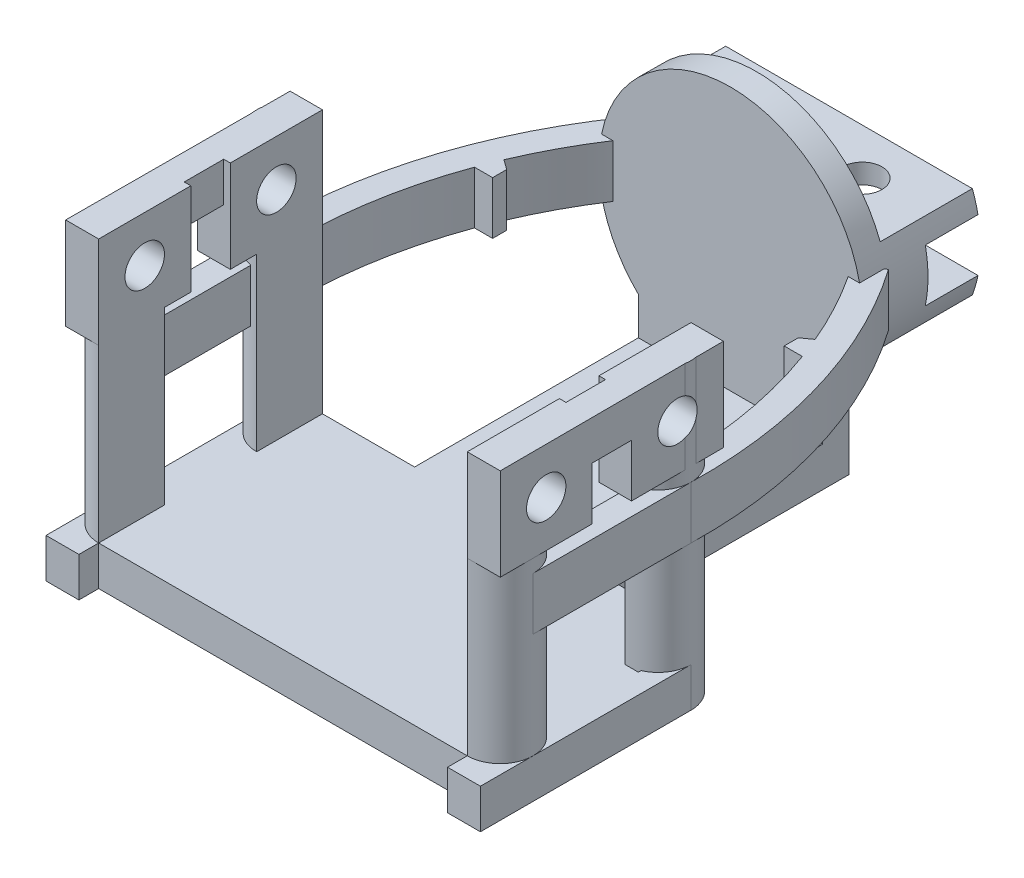
from build123d import *
from build123d.topology import SkipClean

# Parameters (mm, degrees)
BOSS_EXTRUDE1_DEPTH      = 10
BOSS_EXTRUDE2_START      = -1.5
BOSS_EXTRUDE2_DEPTH      = 1.5
SKETCH3_W                = 7
SKETCH3_H                = 1.5
BOSS_EXTRUDE3_DEPTH      = 9.5
SKETCH4_R                = 5
BOSS_EXTRUDE4_DEPTH      = 1
BOSS_EXTRUDE5_DEPTH      = 1
BOSS_EXTRUDE5_DEPTH_BACK = 1
BOSS_EXTRUDE7_START      = -1.5
BOSS_EXTRUDE7_DEPTH      = 1.5
BOSS_EXTRUDE9_DEPTH      = 0.75
BOSS_EXTRUDE9_DEPTH_BACK = 1.5
SKETCH11_W               = 1.25
SKETCH11_H               = 1.5
BOSS_EXTRUDE12_START     = 6.5
BOSS_EXTRUDE12_DEPTH     = 3.5
CUT_EXTRUDE9_DEPTH       = 2
CUT_EXTRUDE9_DEPTH_BACK  = 2
SKETCH16_3_R             = 0.75
BOSS_EXTRUDE13_REACH     = 24.842
SKETCH17_W               = 3.5
SKETCH17_H               = 3.5
SKETCH17_R               = 0.75
CUT_EXTRUDE10_DEPTH      = 2
CUT_EXTRUDE10_DEPTH_BACK = 3
SKETCH17_3_R             = 0.75
BOSS_EXTRUDE14_START     = 3.5
SKETCH18_W               = 4
SKETCH18_H               = 2
BOSS_EXTRUDE14_DEPTH     = 3.5
CUT_EXTRUDE11_DEPTH      = 21.827162
CUT_EXTRUDE11_DEPTH_BACK = 21.827162
SKETCH19_R               = 0.75
SKETCH20_W               = 1.680832
SKETCH20_H               = 2
CUT_EXTRUDE12_DEPTH      = 2
BOSS_EXTRUDE15_START     = -2
BOSS_EXTRUDE15_DEPTH     = 2


# Read off the part's stored shape, not the designer's step: Boss-Extrude12
with BuildPart() as part:
    # Sketch1 → Boss-Extrude1 (new body)
    with BuildSketch(Plane(origin=(0, 0, 0), x_dir=(1, 0, 0), z_dir=(0, 1, 0))):
        with BuildLine():
            ThreePointArc((-7.5, 1.854356), (-7.255387, 1.776367), (-7, 1.75))
            Line((-7, 1.75), (-7, 2.25))
            ThreePointArc((-7, 2.25), (-7.267617, 2.299371), (-7.5, 2.440983))
            Line((-7.5, 2.440983), (-7.5, 1.854356))
        make_face()
        with BuildLine():
            ThreePointArc((-7.5, 3.559017), (-7.267617, 3.700629), (-7, 3.75))
            Line((-7, 3.75), (-7, 4.25))
            ThreePointArc((-7, 4.25), (-7.255387, 4.223633), (-7.5, 4.145644))
            Line((-7.5, 4.145644), (-7.5, 3.559017))
        make_face()
        with BuildLine():
            ThreePointArc((-7.5, 2.440983), (-7.267617, 2.299371), (-7, 2.25))
            Line((-7, 2.25), (-7, 3.75))
            ThreePointArc((-7, 3.75), (-7.267617, 3.700629), (-7.5, 3.559017))
            Line((-7.5, 3.559017), (-7.5, 2.440983))
        make_face()
        with BuildLine():
            ThreePointArc((-8.25, 3), (-8.045825, 2.315347), (-7.5, 1.854356))
            Line((-7.5, 1.854356), (-7.5, 2.440983))
            ThreePointArc((-7.5, 2.440983), (-7.75, 3), (-7.5, 3.559017))
            Line((-7.5, 3.559017), (-7.5, 4.145644))
            ThreePointArc((-7.5, 4.145644), (-8.045825, 3.684653), (-8.25, 3))
        make_face()
        with BuildLine():
            Line((-7.5, -2.440983), (-7.5, -1.854356))
            ThreePointArc((-7.5, -1.854356), (-8.045825, -2.315347), (-8.25, -3))
            ThreePointArc((-8.25, -3), (-8.045825, -3.684653), (-7.5, -4.145644))
            Line((-7.5, -4.145644), (-7.5, -3.559017))
            ThreePointArc((-7.5, -3.559017), (-7.75, -3), (-7.5, -2.440983))
        make_face()
        with BuildLine():
            Line((-7, -2.25), (-7, -1.75))
            ThreePointArc((-7, -1.75), (-7.255387, -1.776367), (-7.5, -1.854356))
            Line((-7.5, -1.854356), (-7.5, -2.440983))
            ThreePointArc((-7.5, -2.440983), (-7.267617, -2.299371), (-7, -2.25))
        make_face()
        with BuildLine():
            Line((-7, -4.25), (-7, -3.75))
            ThreePointArc((-7, -3.75), (-7.267617, -3.700629), (-7.5, -3.559017))
            Line((-7.5, -3.559017), (-7.5, -4.145644))
            ThreePointArc((-7.5, -4.145644), (-7.255387, -4.223633), (-7, -4.25))
        make_face()
        with BuildLine():
            Line((-7, -3.75), (-7, -2.25))
            ThreePointArc((-7, -2.25), (-7.267617, -2.299371), (-7.5, -2.440983))
            Line((-7.5, -2.440983), (-7.5, -3.559017))
            ThreePointArc((-7.5, -3.559017), (-7.267617, -3.700629), (-7, -3.75))
        make_face()
        with BuildLine():
            Line((7, -2.25), (7, -3.75))
            ThreePointArc((7, -3.75), (7.267617, -3.700629), (7.5, -3.559017))
            Line((7.5, -3.559017), (7.5, -2.440983))
            ThreePointArc((7.5, -2.440983), (7.267617, -2.299371), (7, -2.25))
        make_face()
        with BuildLine():
            Line((7, -3.75), (7, -4.25))
            ThreePointArc((7, -4.25), (7.255387, -4.223633), (7.5, -4.145644))
            Line((7.5, -4.145644), (7.5, -3.559017))
            ThreePointArc((7.5, -3.559017), (7.267617, -3.700629), (7, -3.75))
        make_face()
        with BuildLine():
            ThreePointArc((7.5, -1.854356), (7.255387, -1.776367), (7, -1.75))
            Line((7, -1.75), (7, -2.25))
            ThreePointArc((7, -2.25), (7.267617, -2.299371), (7.5, -2.440983))
            Line((7.5, -2.440983), (7.5, -1.854356))
        make_face()
        with BuildLine():
            Line((7.5, -3.559017), (7.5, -4.145644))
            ThreePointArc((7.5, -4.145644), (8.045825, -3.684653), (8.25, -3))
            ThreePointArc((8.25, -3), (8.045825, -2.315347), (7.5, -1.854356))
            Line((7.5, -1.854356), (7.5, -2.440983))
            ThreePointArc((7.5, -2.440983), (7.684653, -2.693814), (7.75, -3))
            ThreePointArc((7.75, -3), (7.684653, -3.306186), (7.5, -3.559017))
        make_face()
        with BuildLine():
            ThreePointArc((7.5, 3.559017), (7.267617, 3.700629), (7, 3.75))
            Line((7, 3.75), (7, 2.25))
            ThreePointArc((7, 2.25), (7.267617, 2.299371), (7.5, 2.440983))
            Line((7.5, 2.440983), (7.5, 3.559017))
        make_face()
        with BuildLine():
            ThreePointArc((7.5, 4.145644), (7.255387, 4.223633), (7, 4.25))
            Line((7, 4.25), (7, 3.75))
            ThreePointArc((7, 3.75), (7.267617, 3.700629), (7.5, 3.559017))
            Line((7.5, 3.559017), (7.5, 4.145644))
        make_face()
        with BuildLine():
            Line((7, 2.25), (7, 1.75))
            ThreePointArc((7, 1.75), (7.255387, 1.776367), (7.5, 1.854356))
            Line((7.5, 1.854356), (7.5, 2.440983))
            ThreePointArc((7.5, 2.440983), (7.267617, 2.299371), (7, 2.25))
        make_face()
        with BuildLine():
            ThreePointArc((8.25, 3), (8.045825, 3.684653), (7.5, 4.145644))
            Line((7.5, 4.145644), (7.5, 3.559017))
            ThreePointArc((7.5, 3.559017), (7.684653, 3.306186), (7.75, 3))
            ThreePointArc((7.75, 3), (7.684653, 2.693814), (7.5, 2.440983))
            Line((7.5, 2.440983), (7.5, 1.854356))
            ThreePointArc((7.5, 1.854356), (8.045825, 2.315347), (8.25, 3))
        make_face()
    extrude(amount=BOSS_EXTRUDE1_DEPTH)

    # Sketch1<5> → Boss-Extrude2 (add)
    with BuildSketch(Plane(origin=(0, 0, 0), x_dir=(1, 0, 0), z_dir=(0, 1, 0)).offset(BOSS_EXTRUDE2_START)):
        with BuildLine():
            Line((-7, -1.75), (-7, 1.75))
            Line((-7, 1.75), (-7.5, 1.75))
            Line((-7.5, 1.75), (-7.5, 1.854356))
            ThreePointArc((-7.5, 1.854356), (-8.045825, 2.315347), (-8.25, 3))
            Line((-8.25, 3), (-8.25, -3))
            ThreePointArc((-8.25, -3), (-8.045825, -2.315347), (-7.5, -1.854356))
            Line((-7.5, -1.854356), (-7.5, -1.75))
            Line((-7.5, -1.75), (-7, -1.75))
        make_face()
        with BuildLine():
            ThreePointArc((-5.75, 3), (-6.116117, 2.116117), (-7, 1.75))
            Line((-7, 1.75), (-7, -1.75))
            ThreePointArc((-7, -1.75), (-6.116117, -2.116117), (-5.75, -3))
            ThreePointArc((-5.75, -3), (-6.116117, -3.883883), (-7, -4.25))
            Line((-7, -4.25), (7, -4.25))
            ThreePointArc((7, -4.25), (5.75, -3), (7, -1.75))
            Line((7, -1.75), (7, 1.75))
            ThreePointArc((7, 1.75), (5.75, 3), (7, 4.25))
            Line((7, 4.25), (-7, 4.25))
            ThreePointArc((-7, 4.25), (-6.116117, 3.883883), (-5.75, 3))
        make_face()
        with BuildLine():
            Line((-7, 2.25), (-7, 1.75))
            ThreePointArc((-7, 1.75), (-6.116117, 2.116117), (-5.75, 3))
            ThreePointArc((-5.75, 3), (-6.116117, 3.883883), (-7, 4.25))
            Line((-7, 4.25), (-7, 3.75))
            ThreePointArc((-7, 3.75), (-6.46967, 3.53033), (-6.25, 3))
            ThreePointArc((-6.25, 3), (-6.46967, 2.46967), (-7, 2.25))
        make_face()
        with BuildLine():
            ThreePointArc((-8.25, 3), (-8.045825, 2.315347), (-7.5, 1.854356))
            Line((-7.5, 1.854356), (-7.5, 2.440983))
            ThreePointArc((-7.5, 2.440983), (-7.75, 3), (-7.5, 3.559017))
            Line((-7.5, 3.559017), (-7.5, 4.145644))
            ThreePointArc((-7.5, 4.145644), (-8.045825, 3.684653), (-8.25, 3))
        make_face()
        with BuildLine():
            ThreePointArc((-7.5, 1.854356), (-7.255387, 1.776367), (-7, 1.75))
            Line((-7, 1.75), (-7, 2.25))
            ThreePointArc((-7, 2.25), (-7.267617, 2.299371), (-7.5, 2.440983))
            Line((-7.5, 2.440983), (-7.5, 1.854356))
        make_face()
        with BuildLine():
            ThreePointArc((-7.5, 3.559017), (-7.267617, 3.700629), (-7, 3.75))
            Line((-7, 3.75), (-7, 4.25))
            ThreePointArc((-7, 4.25), (-7.255387, 4.223633), (-7.5, 4.145644))
            Line((-7.5, 4.145644), (-7.5, 3.559017))
        make_face()
        with BuildLine():
            Line((-7, 3.75), (-7, 2.25))
            ThreePointArc((-7, 2.25), (-6.46967, 2.46967), (-6.25, 3))
            ThreePointArc((-6.25, 3), (-6.46967, 3.53033), (-7, 3.75))
        make_face()
        with BuildLine():
            ThreePointArc((-7.5, 2.440983), (-7.267617, 2.299371), (-7, 2.25))
            Line((-7, 2.25), (-7, 3.75))
            ThreePointArc((-7, 3.75), (-7.267617, 3.700629), (-7.5, 3.559017))
            Line((-7.5, 3.559017), (-7.5, 2.440983))
        make_face()
        with BuildLine():
            ThreePointArc((-7.5, 3.559017), (-7.75, 3), (-7.5, 2.440983))
            Line((-7.5, 2.440983), (-7.5, 3.559017))
        make_face()
        with BuildLine():
            Line((-7.5, -2.440983), (-7.5, -1.854356))
            ThreePointArc((-7.5, -1.854356), (-8.045825, -2.315347), (-8.25, -3))
            ThreePointArc((-8.25, -3), (-8.045825, -3.684653), (-7.5, -4.145644))
            Line((-7.5, -4.145644), (-7.5, -3.559017))
            ThreePointArc((-7.5, -3.559017), (-7.75, -3), (-7.5, -2.440983))
        make_face()
        with BuildLine():
            Line((-7, -2.25), (-7, -1.75))
            ThreePointArc((-7, -1.75), (-7.255387, -1.776367), (-7.5, -1.854356))
            Line((-7.5, -1.854356), (-7.5, -2.440983))
            ThreePointArc((-7.5, -2.440983), (-7.267617, -2.299371), (-7, -2.25))
        make_face()
        with BuildLine():
            Line((-7, -4.25), (-7, -3.75))
            ThreePointArc((-7, -3.75), (-7.267617, -3.700629), (-7.5, -3.559017))
            Line((-7.5, -3.559017), (-7.5, -4.145644))
            ThreePointArc((-7.5, -4.145644), (-7.255387, -4.223633), (-7, -4.25))
        make_face()
        with BuildLine():
            ThreePointArc((-6.25, -3), (-6.46967, -2.46967), (-7, -2.25))
            Line((-7, -2.25), (-7, -3.75))
            ThreePointArc((-7, -3.75), (-6.46967, -3.53033), (-6.25, -3))
        make_face()
        with BuildLine():
            Line((-7, -3.75), (-7, -2.25))
            ThreePointArc((-7, -2.25), (-7.267617, -2.299371), (-7.5, -2.440983))
            Line((-7.5, -2.440983), (-7.5, -3.559017))
            ThreePointArc((-7.5, -3.559017), (-7.267617, -3.700629), (-7, -3.75))
        make_face()
        with BuildLine():
            Line((-7.5, -3.559017), (-7.5, -2.440983))
            ThreePointArc((-7.5, -2.440983), (-7.75, -3), (-7.5, -3.559017))
        make_face()
        with BuildLine():
            ThreePointArc((-5.75, -3), (-6.116117, -2.116117), (-7, -1.75))
            Line((-7, -1.75), (-7, -2.25))
            ThreePointArc((-7, -2.25), (-6.46967, -2.46967), (-6.25, -3))
            ThreePointArc((-6.25, -3), (-6.46967, -3.53033), (-7, -3.75))
            Line((-7, -3.75), (-7, -4.25))
            ThreePointArc((-7, -4.25), (-6.116117, -3.883883), (-5.75, -3))
        make_face()
        with BuildLine():
            ThreePointArc((-7.5, -1.854356), (-7.255387, -1.776367), (-7, -1.75))
            Line((-7, -1.75), (-7.5, -1.75))
            Line((-7.5, -1.75), (-7.5, -1.854356))
        make_face()
        with BuildLine():
            Line((-7.5, 1.75), (-7, 1.75))
            ThreePointArc((-7, 1.75), (-7.255387, 1.776367), (-7.5, 1.854356))
            Line((-7.5, 1.854356), (-7.5, 1.75))
        make_face()
        with BuildLine():
            Line((7.5, 1.75), (7, 1.75))
            Line((7, 1.75), (7, -1.75))
            Line((7, -1.75), (7.5, -1.75))
            Line((7.5, -1.75), (7.5, -1.854356))
            ThreePointArc((7.5, -1.854356), (8.045825, -2.315347), (8.25, -3))
            Line((8.25, -3), (8.25, 3))
            ThreePointArc((8.25, 3), (8.045825, 2.315347), (7.5, 1.854356))
            Line((7.5, 1.854356), (7.5, 1.75))
        make_face()
        with BuildLine():
            Line((7, -3.75), (7, -4.25))
            ThreePointArc((7, -4.25), (7.255387, -4.223633), (7.5, -4.145644))
            Line((7.5, -4.145644), (7.5, -3.559017))
            ThreePointArc((7.5, -3.559017), (7.267617, -3.700629), (7, -3.75))
        make_face()
        with BuildLine():
            ThreePointArc((7.5, -1.854356), (7.255387, -1.776367), (7, -1.75))
            Line((7, -1.75), (7, -2.25))
            ThreePointArc((7, -2.25), (7.267617, -2.299371), (7.5, -2.440983))
            Line((7.5, -2.440983), (7.5, -1.854356))
        make_face()
        with BuildLine():
            ThreePointArc((7, -1.75), (5.75, -3), (7, -4.25))
            Line((7, -4.25), (7, -3.75))
            ThreePointArc((7, -3.75), (6.25, -3), (7, -2.25))
            Line((7, -2.25), (7, -1.75))
        make_face()
        with BuildLine():
            Line((7.5, -3.559017), (7.5, -4.145644))
            ThreePointArc((7.5, -4.145644), (8.045825, -3.684653), (8.25, -3))
            ThreePointArc((8.25, -3), (8.045825, -2.315347), (7.5, -1.854356))
            Line((7.5, -1.854356), (7.5, -2.440983))
            ThreePointArc((7.5, -2.440983), (7.684653, -2.693814), (7.75, -3))
            ThreePointArc((7.75, -3), (7.684653, -3.306186), (7.5, -3.559017))
        make_face()
        with BuildLine():
            Line((7, -2.25), (7, -3.75))
            ThreePointArc((7, -3.75), (7.267617, -3.700629), (7.5, -3.559017))
            Line((7.5, -3.559017), (7.5, -2.440983))
            ThreePointArc((7.5, -2.440983), (7.267617, -2.299371), (7, -2.25))
        make_face()
        with BuildLine():
            Line((7.5, -2.440983), (7.5, -3.559017))
            ThreePointArc((7.5, -3.559017), (7.684653, -3.306186), (7.75, -3))
            ThreePointArc((7.75, -3), (7.684653, -2.693814), (7.5, -2.440983))
        make_face()
        with BuildLine():
            ThreePointArc((7, -2.25), (6.25, -3), (7, -3.75))
            Line((7, -3.75), (7, -2.25))
        make_face()
        with BuildLine():
            Line((7.5, -1.75), (7, -1.75))
            ThreePointArc((7, -1.75), (7.255387, -1.776367), (7.5, -1.854356))
            Line((7.5, -1.854356), (7.5, -1.75))
        make_face()
        with BuildLine():
            ThreePointArc((8.25, 3), (8.045825, 3.684653), (7.5, 4.145644))
            Line((7.5, 4.145644), (7.5, 3.559017))
            ThreePointArc((7.5, 3.559017), (7.684653, 3.306186), (7.75, 3))
            ThreePointArc((7.75, 3), (7.684653, 2.693814), (7.5, 2.440983))
            Line((7.5, 2.440983), (7.5, 1.854356))
            ThreePointArc((7.5, 1.854356), (8.045825, 2.315347), (8.25, 3))
        make_face()
        with BuildLine():
            Line((7, 3.75), (7, 4.25))
            ThreePointArc((7, 4.25), (5.75, 3), (7, 1.75))
            Line((7, 1.75), (7, 2.25))
            ThreePointArc((7, 2.25), (6.25, 3), (7, 3.75))
        make_face()
        with BuildLine():
            ThreePointArc((7.5, 4.145644), (7.255387, 4.223633), (7, 4.25))
            Line((7, 4.25), (7, 3.75))
            ThreePointArc((7, 3.75), (7.267617, 3.700629), (7.5, 3.559017))
            Line((7.5, 3.559017), (7.5, 4.145644))
        make_face()
        with BuildLine():
            Line((7, 2.25), (7, 1.75))
            ThreePointArc((7, 1.75), (7.255387, 1.776367), (7.5, 1.854356))
            Line((7.5, 1.854356), (7.5, 2.440983))
            ThreePointArc((7.5, 2.440983), (7.267617, 2.299371), (7, 2.25))
        make_face()
        with BuildLine():
            ThreePointArc((7.5, 3.559017), (7.267617, 3.700629), (7, 3.75))
            Line((7, 3.75), (7, 2.25))
            ThreePointArc((7, 2.25), (7.267617, 2.299371), (7.5, 2.440983))
            Line((7.5, 2.440983), (7.5, 3.559017))
        make_face()
        with BuildLine():
            Line((7, 2.25), (7, 3.75))
            ThreePointArc((7, 3.75), (6.25, 3), (7, 2.25))
        make_face()
        with BuildLine():
            ThreePointArc((7.75, 3), (7.684653, 3.306186), (7.5, 3.559017))
            Line((7.5, 3.559017), (7.5, 2.440983))
            ThreePointArc((7.5, 2.440983), (7.684653, 2.693814), (7.75, 3))
        make_face()
    extrude(amount=BOSS_EXTRUDE2_DEPTH)

    # Sketch3 → Boss-Extrude3 (add)
    with BuildSketch(Plane(origin=(0, 0, -4.25), x_dir=(-1, 0, 0), z_dir=(0, 0, -1))):
        with Locations((0, -0.75)):
            Rectangle(SKETCH3_W, SKETCH3_H)
    extrude(amount=BOSS_EXTRUDE3_DEPTH)

    # Sketch4 → Boss-Extrude4 (add)
    with BuildSketch(Plane(origin=(0, 0, -13.75), x_dir=(-1, 0, 0), z_dir=(0, 0, -1))):
        with Locations((0, 5)):
            Circle(SKETCH4_R)
        with BuildLine():
            ThreePointArc((3.5, 1.429286), (1.890295, 0.371092), (0, 0))
            Line((0, 0), (3.5, 0))
            Line((3.5, 0), (3.5, 1.429286))
        make_face()
        with BuildLine():
            Line((-3.5, 1.429286), (-3.5, 0))
            Line((-3.5, 0), (0, 0))
            ThreePointArc((0, 0), (-1.890295, 0.371092), (-3.5, 1.429286))
        make_face()
        Polygon((0, 0), (-3.5, 0), (-3.5, -1.5), (3.5, -1.5), (3.5, 0), align=None)
    extrude(amount=-BOSS_EXTRUDE4_DEPTH)

    # Sketch5 → Boss-Extrude5 (add, two sides: drawn at the far end of the back side and taken through both)
    with BuildSketch(Plane(origin=(0, 5, 0), x_dir=(1, 0, 0), z_dir=(0, 1, 0)).offset(-BOSS_EXTRUDE5_DEPTH_BACK)):
        with BuildLine():
            ThreePointArc((-4.180836, 13.176441), (-6.527635, 8.345564), (-7.25028, 3.023663))
            Line((-7.25028, 3.023663), (-8.25, 3))
            ThreePointArc((-8.25, 3), (-7.484846, 8.634953), (-5, 13.75))
            Line((-5, 13.75), (-4.180836, 13.176441))
        make_face()
        with BuildLine():
            Line((5, 13.75), (4.180836, 13.176441))
            ThreePointArc((4.180836, 13.176441), (6.527635, 8.345564), (7.25028, 3.023663))
            Line((7.25028, 3.023663), (8.25, 3))
            ThreePointArc((8.25, 3), (7.484846, 8.634953), (5, 13.75))
        make_face()
        Polygon((7.25028, -3), (7.25028, 3.023663), (8.25, 3), (8.25, -3), align=None)
        Polygon((-7.25028, -3), (-8.25, -3), (-8.25, 3), (-7.25028, 3.023663), align=None)
        with BuildLine():
            ThreePointArc((5.453916, 13.069292), (5.230826, 13.412225), (5, 13.75))
            Line((5, 13.75), (4.551765, 13.436157))
            Line((4.551765, 13.436157), (5, 12.75))
            ThreePointArc((5, 12.75), (5.2297, 12.905747), (5.453916, 13.069292))
        make_face()
        with BuildLine():
            Line((-4.551765, 13.436157), (-5, 13.75))
            ThreePointArc((-5, 13.75), (-5.230826, 13.412225), (-5.453916, 13.069292))
            ThreePointArc((-5.453916, 13.069292), (-5.2297, 12.905747), (-5, 12.75))
            Line((-5, 12.75), (-4.551765, 13.436157))
        make_face()
    extrude(amount=BOSS_EXTRUDE5_DEPTH + BOSS_EXTRUDE5_DEPTH_BACK)

    # Sketch7 → Boss-Extrude7 (add)
    with BuildSketch(Plane(origin=(0, 10, 0), x_dir=(1, 0, 0), z_dir=(0, 1, 0)).offset(BOSS_EXTRUDE7_START)):
        with BuildLine():
            ThreePointArc((-7.25028, 1.775312), (-7.899332, 2.13184), (-8.232751, 2.79306))
            Line((-8.232751, 2.79306), (-8.25, -3))
            Line((-8.25, -3), (-7.25028, -3))
            Line((-7.25028, -3), (-7.25028, 1.775312))
        make_face()
        Polygon((7.25028, -3), (7.25028, 3.023663), (8.232622, 2.836568), (8.25, -3), align=None)
    extrude(amount=BOSS_EXTRUDE7_DEPTH)

    # Sketch11 → Boss-Extrude9 (add, two sides: drawn at the far end of the back side and taken through both)
    with BuildSketch(Plane.XY.offset(4.25).offset(-BOSS_EXTRUDE9_DEPTH_BACK)):
        with Locations((-7.625, -0.75)):
            Rectangle(SKETCH11_W, SKETCH11_H)
        with Locations((7.625, -0.75)):
            Rectangle(SKETCH11_W, SKETCH11_H)
    extrude(amount=BOSS_EXTRUDE9_DEPTH + BOSS_EXTRUDE9_DEPTH_BACK)

    # Boss-Extrude12 outline → Boss-Extrude12 (add)
    with BuildSketch(Plane(origin=(0, 0, 0), x_dir=(1, 0, 0), z_dir=(0, 1, 0)).offset(BOSS_EXTRUDE12_START)):
        with BuildLine():
            ThreePointArc((-8.231497, 3.214278), (-7.804566, 3.956647), (-7, 4.25))
            Line((-7, 4.25), (-8.228413, 4.25))
            Line((-8.228413, 4.25), (-8.231497, 3.214278))
        make_face()
        with BuildLine():
            Line((-7, 0.75), (-7, 1.75))
            ThreePointArc((-7, 1.75), (-7.807411, 2.045753), (-8.232751, 2.79306))
            Line((-8.232751, 2.79306), (-8.238834, 0.75))
            Line((-8.238834, 0.75), (-7, 0.75))
        make_face()
        with BuildLine():
            ThreePointArc((-8.249994, -2.996278), (-7.882567, -2.114802), (-7, -1.75))
            Line((-7, -1.75), (-7, -0.75))
            Line((-7, -0.75), (-8.243301, -0.75))
            Line((-8.243301, -0.75), (-8.249994, -2.996278))
        make_face()
        with BuildLine():
            ThreePointArc((-7, -4.25), (-7.885198, -3.882567), (-8.249994, -2.996278))
            Line((-8.249994, -2.996278), (-8.253722, -4.25))
            Line((-8.253722, -4.25), (-7, -4.25))
        make_face()
        with BuildLine():
            Line((-7.5, -3.559017), (-7.5, -2.440983))
            ThreePointArc((-7.5, -2.440983), (-7.75, -3), (-7.5, -3.559017))
        make_face()
        with BuildLine():
            ThreePointArc((-7.5, 3.559017), (-7.75, 3), (-7.5, 2.440983))
            Line((-7.5, 2.440983), (-7.5, 3.559017))
        make_face()
    extrude(amount=BOSS_EXTRUDE12_DEPTH)

    # Sketch16<3> → Cut-Extrude9 (cut, two sides: drawn at the far end of the back side and taken through both)
    with BuildSketch(Plane(origin=(-7, 0, 0), x_dir=(0, 0, -1), z_dir=(1, 0, 0)).offset(-CUT_EXTRUDE9_DEPTH_BACK)):
        with Locations(Location((-2.5, 8.25, 0), (0, 0, 180))):
            Circle(SKETCH16_3_R)
        with Locations(Location((2.5, 8.25, 0), (0, 0, 293.000928))):
            Circle(SKETCH16_3_R)
    extrude(amount=CUT_EXTRUDE9_DEPTH + CUT_EXTRUDE9_DEPTH_BACK, mode=Mode.SUBTRACT)

    # Boss-Extrude13: up to this plane
    boss_extrude13_end = Plane(origin=(8.240994, 8.5, -0.024537), z_dir=(0.9999955673191335, 0, -0.0029774724321619656))
    # Sketch17 → Boss-Extrude13 (add, up to the surface)
    with BuildSketch(Plane.ZY.offset(-7), mode=Mode.PRIVATE) as boss_extrude13_sk1:
        with Locations((-2.5, 8.25)):
            Rectangle(SKETCH17_W, SKETCH17_H)
        with Locations(Location((-2.5, 8.25, 0), (0, 0, 246.999072))):
            Circle(SKETCH17_R, mode=Mode.SUBTRACT)
    boss_extrude13_tool1 = split(extrude(boss_extrude13_sk1.sketch, amount=-BOSS_EXTRUDE13_REACH, mode=Mode.PRIVATE), bisect_by=boss_extrude13_end, keep=Keep.BOTH, mode=Mode.PRIVATE)
    add(boss_extrude13_tool1.solids().sort_by_distance((7, 6.549497, -2.5))[0])
    # Sketch17 → Boss-Extrude13 (add, up to the surface)
    with BuildSketch(Plane.ZY.offset(-7), mode=Mode.PRIVATE) as boss_extrude13_sk2:
        with Locations(Location((-2.5, 8.25, 0), (0, 0, 246.999072))):
            Circle(SKETCH17_R)
    boss_extrude13_tool2 = split(extrude(boss_extrude13_sk2.sketch, amount=-BOSS_EXTRUDE13_REACH, mode=Mode.PRIVATE), bisect_by=boss_extrude13_end, keep=Keep.BOTH, mode=Mode.PRIVATE)
    add(boss_extrude13_tool2.solids().sort_by_distance((7, 8.25, -2.5))[0])
    # Sketch17 → Boss-Extrude13 (add, up to the surface)
    with BuildSketch(Plane.ZY.offset(-7), mode=Mode.PRIVATE) as boss_extrude13_sk3:
        Polygon((0.75, 10), (0.75, 6.5), (1.75, 6.5), (1.75, 8.25), (1.75, 10), align=None)
    boss_extrude13_tool3 = split(extrude(boss_extrude13_sk3.sketch, amount=-BOSS_EXTRUDE13_REACH, mode=Mode.PRIVATE), bisect_by=boss_extrude13_end, keep=Keep.BOTH, mode=Mode.PRIVATE)
    add(boss_extrude13_tool3.solids().sort_by_distance((7, 8.25, 1.25))[0])
    # Sketch17 → Boss-Extrude13 (add, up to the surface)
    with BuildSketch(Plane.ZY.offset(-7), mode=Mode.PRIVATE) as boss_extrude13_sk4:
        Polygon((1.75, 8.25), (1.75, 6.5), (4.25, 6.5), (4.25, 10), (1.75, 10), align=None)
        with BuildLine():
            ThreePointArc((3.25, 8.25), (2.5, 7.5), (1.75, 8.25))
            ThreePointArc((1.75, 8.25), (2.5, 9), (3.25, 8.25))
        make_face(mode=Mode.SUBTRACT)
    boss_extrude13_tool4 = split(extrude(boss_extrude13_sk4.sketch, amount=-BOSS_EXTRUDE13_REACH, mode=Mode.PRIVATE), bisect_by=boss_extrude13_end, keep=Keep.BOTH, mode=Mode.PRIVATE)
    add(boss_extrude13_tool4.solids().sort_by_distance((7, 7.375, 1.793012))[0])
    # Sketch17 → Boss-Extrude13 (add, up to the surface)
    with BuildSketch(Plane.ZY.offset(-7), mode=Mode.PRIVATE) as boss_extrude13_sk5:
        with Locations((2.5, 8.25)):
            Circle(SKETCH17_R)
    boss_extrude13_tool5 = split(extrude(boss_extrude13_sk5.sketch, amount=-BOSS_EXTRUDE13_REACH, mode=Mode.PRIVATE), bisect_by=boss_extrude13_end, keep=Keep.BOTH, mode=Mode.PRIVATE)
    add(boss_extrude13_tool5.solids().sort_by_distance((7, 8.25, 2.5))[0])

    # Sketch17<3> → Cut-Extrude10 (cut, two sides: drawn at the far end of the back side and taken through both)
    with BuildSketch(Plane.ZY.offset(-7).offset(-CUT_EXTRUDE10_DEPTH_BACK)):
        with Locations(Location((-2.5, 8.25, 0), (0, 0, 246.999072))):
            Circle(SKETCH17_3_R)
        with Locations((2.5, 8.25)):
            Circle(SKETCH17_3_R)
    extrude(amount=CUT_EXTRUDE10_DEPTH + CUT_EXTRUDE10_DEPTH_BACK, mode=Mode.SUBTRACT)

    # Sketch18 → Boss-Extrude14 (add)
    with BuildSketch(Plane(origin=(0, 0, -13.75), x_dir=(-1, 0, 0), z_dir=(0, 0, -1)).offset(BOSS_EXTRUDE14_START)):
        with BuildLine():
            ThreePointArc((-4.683748, 6.75), (-5, 5), (-4.683748, 3.25))
            Line((-4.683748, 3.25), (4.683748, 3.25))
            ThreePointArc((4.683748, 3.25), (5, 5), (4.683748, 6.75))
            Line((4.683748, 6.75), (-4.683748, 6.75))
        make_face()
        with Locations((2.25, 5)):
            Rectangle(SKETCH18_W, SKETCH18_H, mode=Mode.SUBTRACT)
        with Locations((-2.25, 5)):
            Rectangle(SKETCH18_W, SKETCH18_H, mode=Mode.SUBTRACT)
    extrude(amount=-BOSS_EXTRUDE14_DEPTH)

    # Sketch19 → Cut-Extrude11 (cut, two sides: drawn at the far end of the back side and taken through both)
    with BuildSketch(Plane(origin=(0, 6.75, 0), x_dir=(1, 0, 0), z_dir=(0, 1, 0)).offset(-CUT_EXTRUDE11_DEPTH_BACK)):
        with Locations(Location((-2.25, 15.5, 0), (0, 0, 270))):
            Circle(SKETCH19_R)
        with Locations(Location((2.25, 15.5, 0), (0, 0, 90))):
            Circle(SKETCH19_R)
    extrude(amount=CUT_EXTRUDE11_DEPTH + CUT_EXTRUDE11_DEPTH_BACK, mode=Mode.SUBTRACT)

    # Sketch20 → Cut-Extrude12 (cut)
    with BuildSketch(Plane(origin=(0, 0, -17.25), x_dir=(-1, 0, 0), z_dir=(0, 0, -1))):
        with Locations((4.530754, 5)):
            Rectangle(SKETCH20_W, SKETCH20_H)
        with Locations((-4.530754, 5)):
            Rectangle(SKETCH20_W, SKETCH20_H)
    extrude(amount=-CUT_EXTRUDE12_DEPTH, mode=Mode.SUBTRACT)

    # Sketch21 → Boss-Extrude15 (add)
    with SkipClean():  # the faces are left unmerged after this step: merging them gives an invalid solid
        with BuildSketch(Plane(origin=(0, 6, 0), x_dir=(1, 0, 0), z_dir=(0, 1, 0)).offset(BOSS_EXTRUDE15_START)):
            with BuildLine():
                ThreePointArc((-6.742731, 10.647857), (-7.029326, 9.954598), (-7.286786, 9.25))
                Line((-7.286786, 9.25), (-5.536786, 9.25))
                Line((-5.536786, 9.25), (-5.536786, 9.786003))
                Line((-5.536786, 9.786003), (-6.742731, 10.647857))
            make_face()
            with BuildLine():
                Line((5.536786, 9.786003), (5.536786, 9.25))
                Line((5.536786, 9.25), (6.226276, 9.25))
                ThreePointArc((6.226276, 9.25), (6.07333, 9.65344), (5.910195, 10.052868))
                Line((5.910195, 10.052868), (5.536786, 9.786003))
            make_face()
            with BuildLine():
                ThreePointArc((5.910195, 10.052868), (6.07333, 9.65344), (6.226276, 9.25))
                Line((6.226276, 9.25), (7.286786, 9.25))
                ThreePointArc((7.286786, 9.25), (7.029326, 9.954598), (6.742731, 10.647857))
                Line((6.742731, 10.647857), (5.910195, 10.052868))
            make_face()
        extrude(amount=BOSS_EXTRUDE15_DEPTH)


solid = part.part
